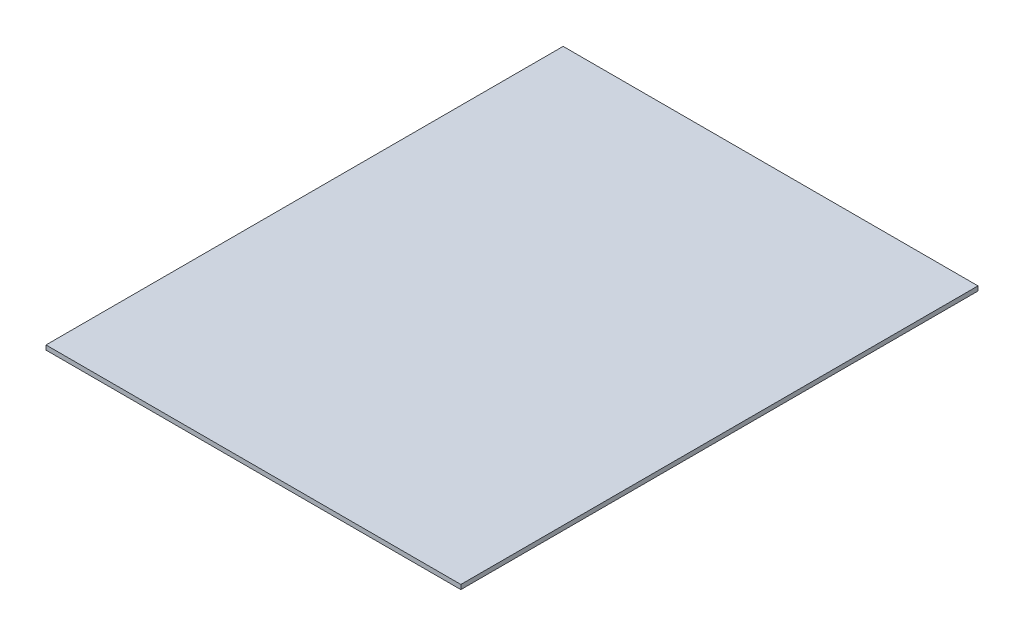
from build123d import *

# Parameters (mm, degrees)
SKETCH1_W           = 585.7875
SKETCH1_H           = 730.25
BOSS_EXTRUDE1_DEPTH = 6.35


with BuildPart() as part:
    # Sketch1 → Boss-Extrude1 (new body)
    with BuildSketch(Plane(origin=(0, 0, 0), x_dir=(1, 0, 0), z_dir=(0, 1, 0))):
        Rectangle(SKETCH1_W, SKETCH1_H)
    extrude(amount=BOSS_EXTRUDE1_DEPTH)


solid = part.part
